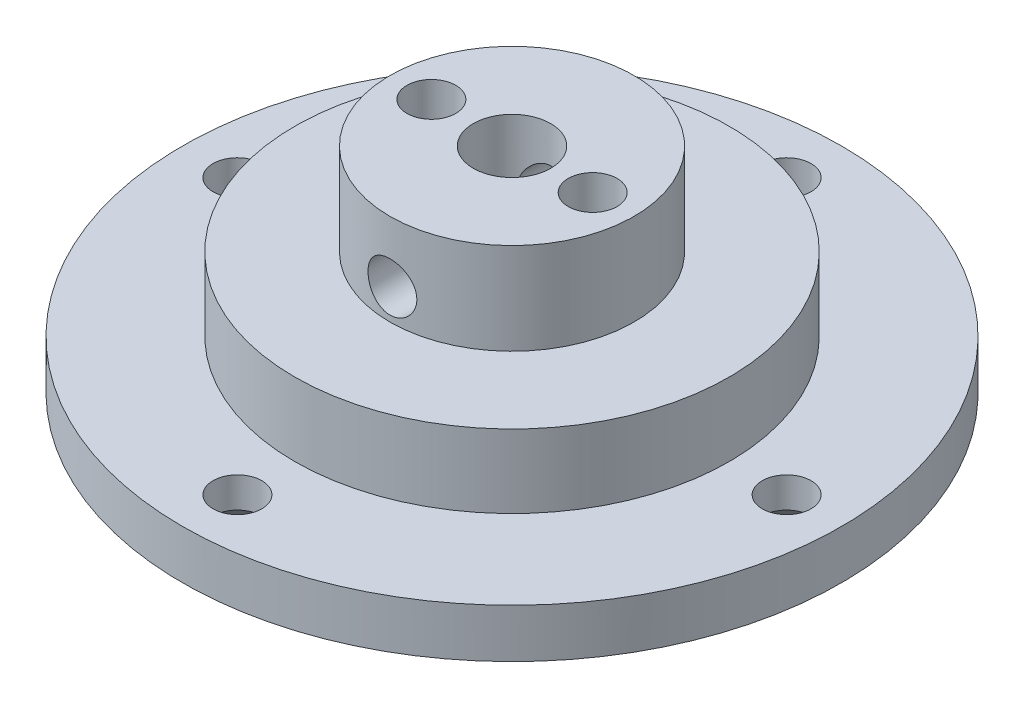
from build123d import *

# Parameters (mm, degrees)
SKETCH_1_R          = 27
SKETCH_1_R_2        = 3.175
EXTRUDE_1_DEPTH     = 16
CUT_EXTRUDE_START   = -7.5
SKETCH_2_R          = 27
SKETCH_2_R_2        = 10
CUT_EXTRUDE_1_DEPTH = 7.5
SKETCH_3_R          = 15
CUT_EXTRUDE_2_DEPTH = 6
CUT_EXTRUDE_START_2 = -6
SKETCH_4_R          = 27
SKETCH_4_R_2        = 17.8
CUT_EXTRUDE_3_DEPTH = 6
SKETCH_5_R          = 2
CUT_EXTRUDE_4_DEPTH = 16.25
EXTRUDE_START       = 1.5
SKETCH_6_R          = 27
SKETCH_6_R_2        = 15
EXTRUDE_5_DEPTH     = 1.5
SKETCH_7_R          = 2
CUT_EXTRUDE_6_DEPTH = 41.500000033
CHAMFER_1_SIZE      = 1.5
SKETCH_8_R          = 2
CUT_EXTRUDE_7_DEPTH = 43.002976085


with BuildPart() as part:
    # Эскиз1 → Вытянуть1 (new body)
    with BuildSketch(Plane(origin=(0, 0, 0), x_dir=(1, 0, 0), z_dir=(0, 1, 0))):
        Circle(SKETCH_1_R)
        Circle(SKETCH_1_R_2, mode=Mode.SUBTRACT)
    extrude(amount=EXTRUDE_1_DEPTH)

    # Эскиз2 → Вырез-Вытянуть1 (cut)
    with BuildSketch(Plane(origin=(0, 16, 0), x_dir=(1, 0, 0), z_dir=(0, 1, 0)).offset(CUT_EXTRUDE_START)):
        Circle(SKETCH_2_R)
        Circle(SKETCH_2_R_2, mode=Mode.SUBTRACT)
    extrude(amount=CUT_EXTRUDE_1_DEPTH, mode=Mode.SUBTRACT)

    # Эскиз3 → Вытянуть2 (cut)
    with BuildSketch(Plane.XZ):
        Circle(SKETCH_3_R)
    extrude(amount=-CUT_EXTRUDE_2_DEPTH, mode=Mode.SUBTRACT)

    # Эскиз4 → Вытянуть3 (cut)
    with BuildSketch(Plane(origin=(0, 8.5, 0), x_dir=(1, 0, 0), z_dir=(0, 1, 0)).offset(CUT_EXTRUDE_START_2)):
        Circle(SKETCH_4_R)
        Circle(SKETCH_4_R_2, mode=Mode.SUBTRACT)
    extrude(amount=CUT_EXTRUDE_3_DEPTH, mode=Mode.SUBTRACT)

    # Эскиз5 → Вытянуть4 (cut, symmetric)
    with BuildSketch(Plane.XY):
        with Locations((0, 11)):
            Circle(SKETCH_5_R)
    extrude(amount=CUT_EXTRUDE_4_DEPTH, both=True, mode=Mode.SUBTRACT)

    # Эскиз6 → Вытянуть5 (add)
    with BuildSketch(Plane.XZ.offset(EXTRUDE_START)):
        Circle(SKETCH_6_R)
        Circle(SKETCH_6_R_2, mode=Mode.SUBTRACT)
    extrude(amount=-EXTRUDE_5_DEPTH)

    # Эскиз7 → Вытянуть6 (cut, through all)
    with BuildSketch(Plane(origin=(0, 2.5, 0), x_dir=(1, 0, 0), z_dir=(0, 1, 0))):
        with Locations((0, 22.5)):
            Circle(SKETCH_7_R)
        with Locations((22.5, 0)):
            Circle(SKETCH_7_R)
        with Locations((0, -22.5)):
            Circle(SKETCH_7_R)
        with Locations((-22.5, 0)):
            Circle(SKETCH_7_R)
    extrude(amount=-CUT_EXTRUDE_6_DEPTH, mode=Mode.SUBTRACT)

    # Фаска1
    chamfer_1_edges = [part.edges().sort_by_distance(p)[0] for p in [
        (-24.5, -1.5, 0),
        (-2, -1.5, -22.5),
        (20.5, -1.5, 0),
        (-2, -1.5, 22.5),
    ]]
    chamfer(chamfer_1_edges, length=CHAMFER_1_SIZE)

    # Эскиз8 → Вытянуть7 (cut, through all)
    with BuildSketch(Plane(origin=(0, 16, 0), x_dir=(1, 0, 0), z_dir=(0, 1, 0))):
        with Locations((-6.60744303, 0)):
            Circle(SKETCH_8_R)
        with Locations((6.60744303, 0)):
            Circle(SKETCH_8_R)
    extrude(amount=-CUT_EXTRUDE_7_DEPTH, mode=Mode.SUBTRACT)


solid = part.part
